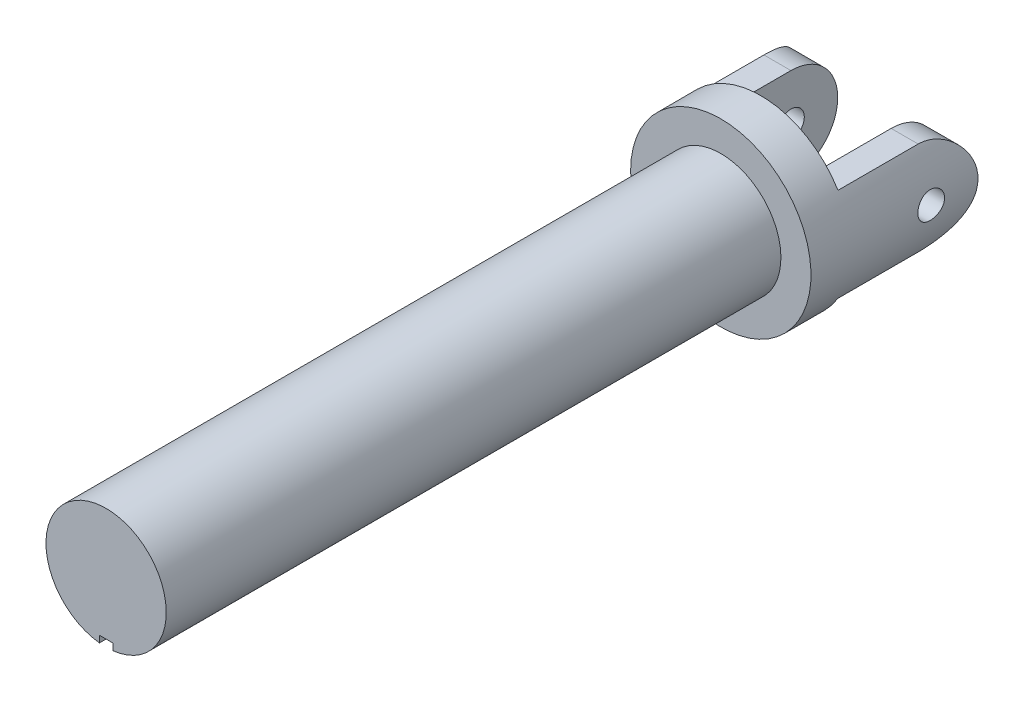
from build123d import *
from build123d.topology import SkipClean

# Parameters (mm, degrees)
SKETCH1_R                = 4.5
YOKE_DEPTH               = 23
SKETCH2_R                = 6.75
U_JOINT_BASE_DEPTH       = 3
U_JOINT_STANDUPS_DEPTH   = 9.5
STANDUP_ROUND_DEPTH      = 37.76105276
STANDUP_ROUND_DEPTH_BACK = 37.76105276
BALL_HOLES_DEPTH         = 37.761052875
BALL_HOLES_DEPTH_BACK    = 37.761052875
SKETCH5_R                = 1
KEYWAY_DEPTH             = 46


with BuildPart() as part:
    # Sketch1 → Yoke (new, symmetric)
    with BuildSketch(Plane.XY):
        Circle(SKETCH1_R)
    extrude(amount=YOKE_DEPTH, both=True)

    # Sketch2 → U Joint Base (add)
    with BuildSketch(Plane(origin=(0, 0, -23), x_dir=(-1, 0, 0), z_dir=(0, 0, -1))):
        Circle(SKETCH2_R)
    extrude(amount=U_JOINT_BASE_DEPTH)

    # Sketch3 → U Joint Standups (add)
    with SkipClean():  # the faces are left unmerged after this step: merging them gives an invalid solid
        with BuildSketch(Plane(origin=(0, 0, -26), x_dir=(-1, 0, 0), z_dir=(0, 0, -1))):
            with BuildLine():
                Line((-5.77169819, 3.5), (-3.75, 3.5))
                Line((-3.75, 3.5), (-3.75, -3.5))
                Line((-3.75, -3.5), (-5.77169819, -3.5))
                ThreePointArc((-5.77169819, -3.5), (-6.75, 0), (-5.77169819, 3.5))
            make_face()
            with BuildLine():
                Line((3.75, -3.5), (3.75, 3.5))
                Line((3.75, 3.5), (5.77169819, 3.5))
                ThreePointArc((5.77169819, 3.5), (6.75, 0), (5.77169819, -3.5))
                Line((5.77169819, -3.5), (3.75, -3.5))
            make_face()
        extrude(amount=U_JOINT_STANDUPS_DEPTH)

    # Sketch4 → Standup Round (cut, two sides: drawn at the far end of the back side and taken through both)
    with SkipClean():  # the faces are left unmerged after this step: merging them gives an invalid solid
        with BuildSketch(Plane(origin=(0, 0, 0), x_dir=(0, 0, -1), z_dir=(1, 0, 0)).offset(-STANDUP_ROUND_DEPTH_BACK)):
            with BuildLine():
                ThreePointArc((35.5, 0), (34.474873734, -2.474873734), (32, -3.5))
                Line((32, -3.5), (35.5, -3.5))
                Line((35.5, -3.5), (35.5, 0))
            make_face()
            with BuildLine():
                ThreePointArc((32, 3.5), (34.474873734, 2.474873734), (35.5, 0))
                Line((35.5, 0), (35.5, 3.5))
                Line((35.5, 3.5), (32, 3.5))
            make_face()
        extrude(amount=STANDUP_ROUND_DEPTH + STANDUP_ROUND_DEPTH_BACK, mode=Mode.SUBTRACT)

    # Sketch5 → Ball Holes (cut, two sides: drawn at the far end of the back side and taken through both)
    with SkipClean():  # the faces are left unmerged after this step: merging them gives an invalid solid
        with BuildSketch(Plane(origin=(0, 0, 0), x_dir=(0, 0, -1), z_dir=(1, 0, 0)).offset(-BALL_HOLES_DEPTH_BACK)):
            with Locations((32, 0)):
                Circle(SKETCH5_R)
        extrude(amount=BALL_HOLES_DEPTH + BALL_HOLES_DEPTH_BACK, mode=Mode.SUBTRACT)

    # Sketch6 → Keyway (cut)
    with SkipClean():  # the faces are left unmerged after this step: merging them gives an invalid solid
        with BuildSketch(Plane.XY.offset(23)):
            Polygon((0.5, -4.472135955), (0.5, -4.702036395), (-0.5, -4.702036395), (-0.5, -4.472135955), (-0.5, -3.972135955), (0.5, -3.972135955), align=None)
        extrude(amount=-KEYWAY_DEPTH, mode=Mode.SUBTRACT)


solid = part.part
